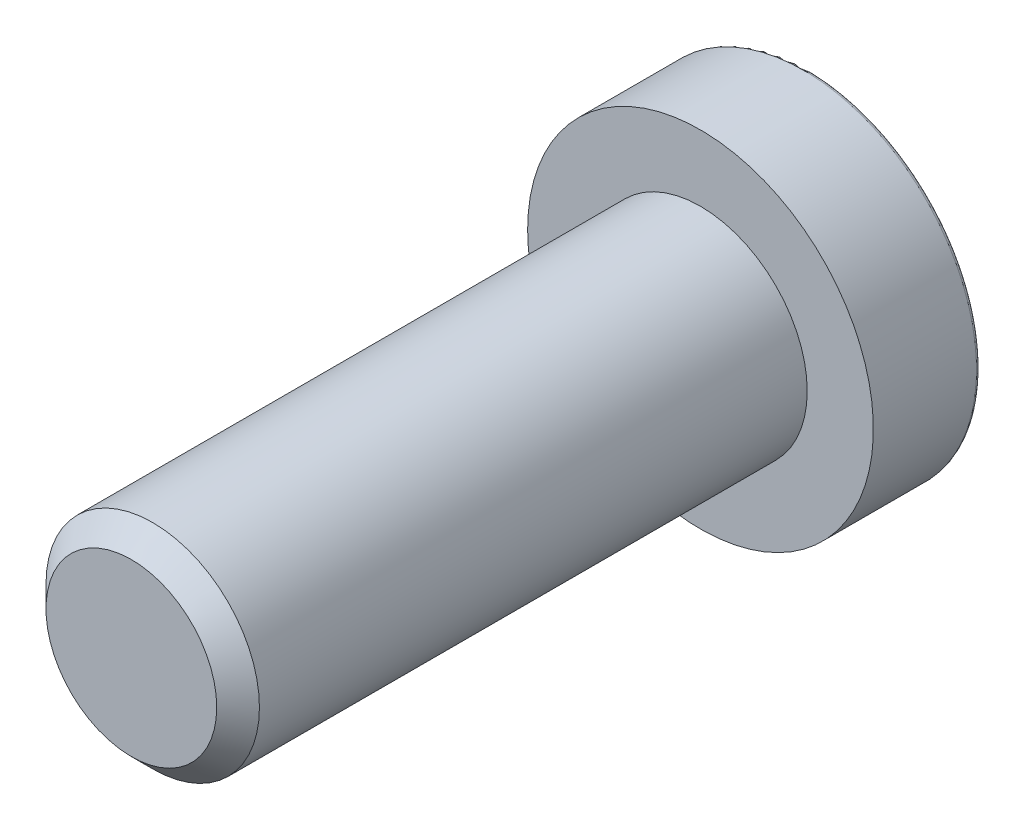
from build123d import *

# Parameters (mm, degrees)
ENLEV_MAT_EXTRU1_DEPTH = 1.3
ESQUISSE3_W            = 1.5
ESQUISSE3_H            = 8
CHANFREIN1_SIZE        = 0.3


with BuildPart() as part:
    # Esquisse1 → Base-Révolution (revolve)
    with BuildSketch(Plane(origin=(0, 0, 0), x_dir=(1, 0, 0), z_dir=(0, 1, 0)), mode=Mode.PRIVATE) as base_r_volution_sk:
        with BuildLine():
            Line((0, 0), (2.43, 0))
            Line((2.43, 0), (2.43, 1.45))
            ThreePointArc((2.43, 1.45), (2.415355339, 1.485355339), (2.38, 1.5))
            Line((2.38, 1.5), (0, 1.5))
            Line((0, 1.5), (0, 0))
        make_face()
    revolve(base_r_volution_sk.sketch.rotate(Axis((0, 0, 0), (0, 0, -1)), 180), axis=Axis((0, 0, 0), (0, 0, -1)))

    # Esquisse2 → enlev-mat-Extru1 (cut)
    with BuildSketch(Plane.XY.offset(-1.5)):
        Polygon((1.025891605, -0.592298794), (1.025891605, 0.592298794), (0, 1.184597588), (-1.025891605, 0.592298794), (-1.025891605, -0.592298794), (0, -1.184597588), align=None)
    extrude(amount=ENLEV_MAT_EXTRU1_DEPTH, mode=Mode.SUBTRACT)

    # Esquisse3 → Boss.-Révol.1 (revolve)
    with BuildSketch(Plane(origin=(0, 0, 0), x_dir=(1, 0, 0), z_dir=(0, 1, 0))):
        with Locations((0.75, -4)):
            Rectangle(ESQUISSE3_W, ESQUISSE3_H)
    revolve(axis=Axis((0, 0, 0), (0, 0, 1)))

    # Chanfrein1
    chanfrein1_edges = [part.edges().sort_by_distance(p)[0] for p in [
        (-1.5, 0, 8),
    ]]
    chamfer(chanfrein1_edges, length=CHANFREIN1_SIZE)


solid = part.part
